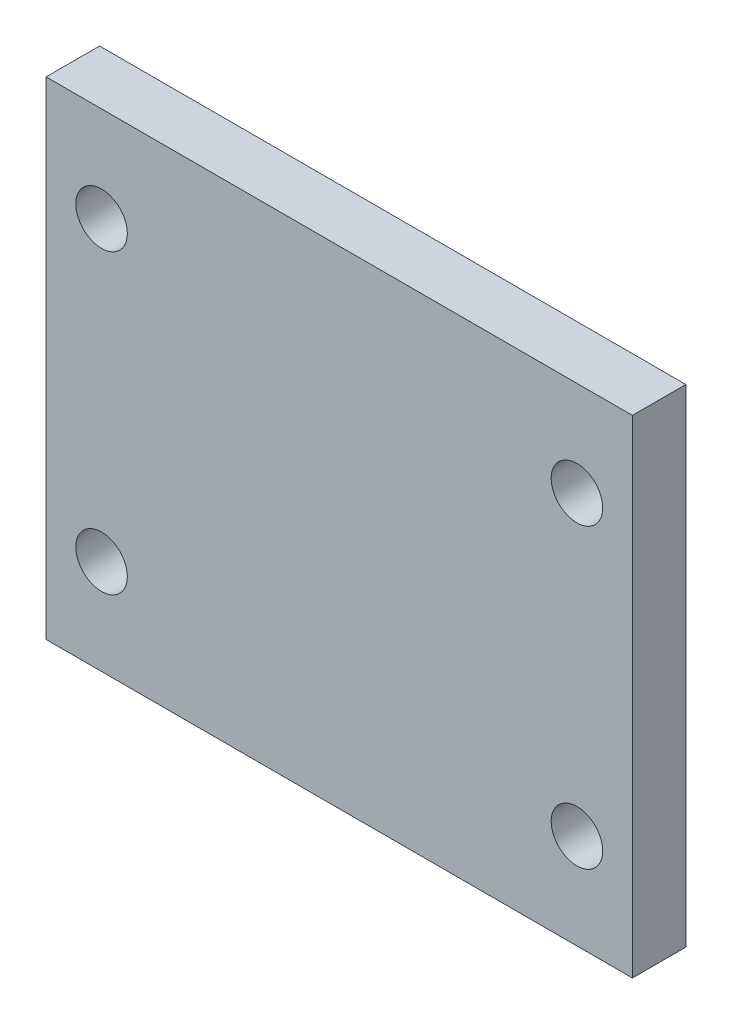
from build123d import *

# Parameters (mm, degrees)
SKETCH1_W      = 296
SKETCH1_H      = 246
SKETCH1_R      = 13
EXTRUDE1_DEPTH = 27


with BuildPart() as part:
    # Sketch1 → Extrude1 (new body)
    with BuildSketch(Plane.XY):
        Rectangle(SKETCH1_W, SKETCH1_H)
        with Locations((-120, 75)):
            Circle(SKETCH1_R, mode=Mode.SUBTRACT)
        with Locations((120, 75)):
            Circle(SKETCH1_R, mode=Mode.SUBTRACT)
        with Locations((120, -75)):
            Circle(SKETCH1_R, mode=Mode.SUBTRACT)
        with Locations((-120, -75)):
            Circle(SKETCH1_R, mode=Mode.SUBTRACT)
    extrude(amount=EXTRUDE1_DEPTH)


solid = part.part
